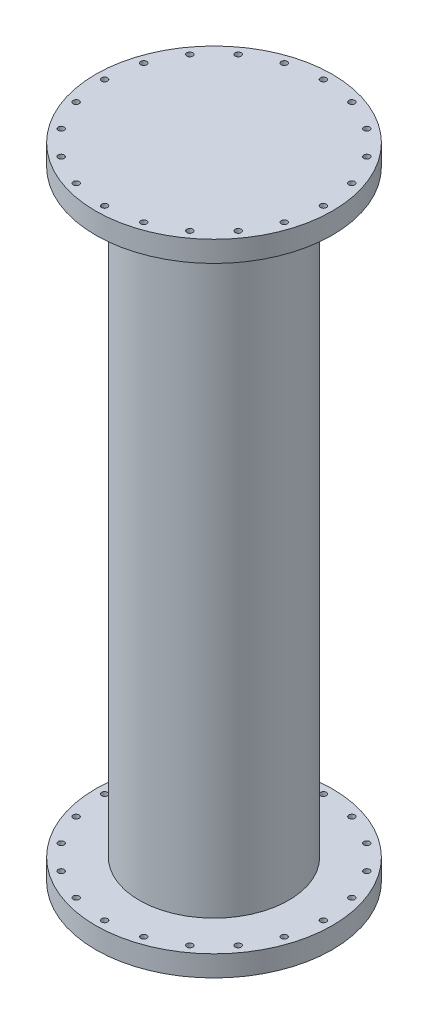
from build123d import *

# Parameters (mm, degrees)
ESQUISSE2_R                  = 10
ENL_V_MAT_EXTRU_1_DEPTH      = 2213.0650985
R_P_TITION_CIRCULAIRE1_COUNT = 20


with BuildPart() as part:
    # Esquisse1 → Révolution1 (revolve)
    with BuildSketch(Plane.XY):
        Polygon((0, 0), (396, 0), (396, -70), (250, -70), (250, -2070), (396, -2070), (396, -2140), (0, -2140), (0, -2070), (200, -2070), (200, -70), (0, -70), align=None)
    revolve(axis=Axis((0, 0, 0), (0, -1, 0)))

    # Esquisse2 → Enlèv. mat.-Extru.1 (cut, through all)
    with BuildSketch(Plane(origin=(0, 0, 0), x_dir=(1, 0, 0), z_dir=(0, 1, 0))):
        with Locations((366, 0)):
            Circle(ESQUISSE2_R)
    enl_v_mat_extru_1 = extrude(amount=-ENL_V_MAT_EXTRU_1_DEPTH, mode=Mode.SUBTRACT)

    # Répétition circulaire1: Enlèv. mat.-Extru.1 ×20 about axis
    r_p_tition_circulaire1_axis = Axis((0, 0, 0), (0, 1, 0))
    for i in range(1, R_P_TITION_CIRCULAIRE1_COUNT):
        add(enl_v_mat_extru_1.rotate(r_p_tition_circulaire1_axis, i * 360 / R_P_TITION_CIRCULAIRE1_COUNT), mode=Mode.SUBTRACT)


solid = part.part
